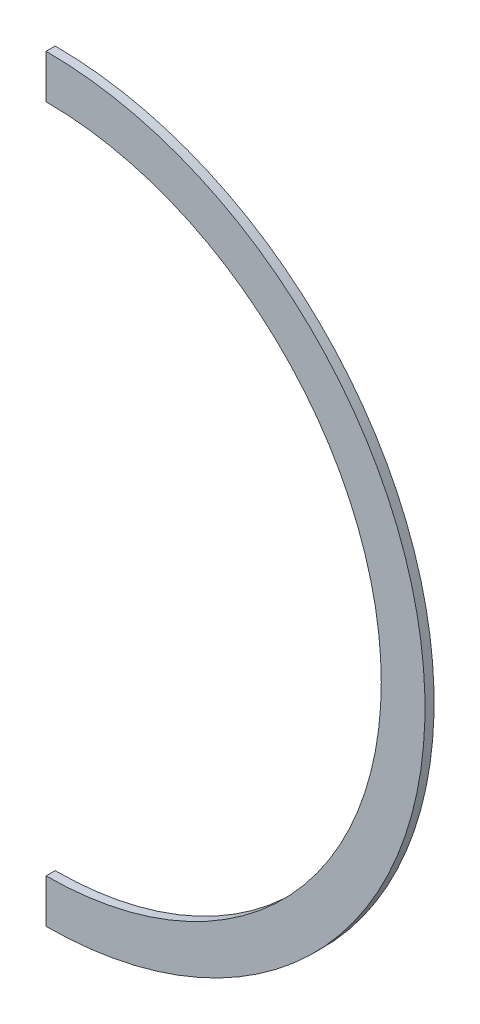
from build123d import *

# Parameters (mm, degrees)
SKETCH2_R           = 116.84
BOSS_EXTRUDE1_DEPTH = 1.5875
SKETCH3_W           = 232.210592103
SKETCH3_H           = 398.954583541
CUT_EXTRUDE1_DEPTH  = 190.3271535


with BuildPart() as part:
    # Sketch2 → Boss-Extrude1 (new, symmetric)
    with BuildSketch(Plane.XY):
        with BuildLine():
            ThreePointArc((-1.651, 128.513680847), (-113.442050185, 64.090342472), (-116.977164172, -64.88681984))
            ThreePointArc((-116.977164172, -64.88681984), (-116.591332217, -65.617160575), (-116.200940475, -66.34507415))
            ThreePointArc((-116.200940475, -66.34507415), (-115.806144035, -67.070277165), (-115.406821703, -67.79299794))
            ThreePointArc((-115.406821703, -67.79299794), (0, -135.636), (115.406821703, -67.79299794))
            ThreePointArc((115.406821703, -67.79299794), (115.8045128, -67.073251319), (116.19771518, -66.351042694))
            ThreePointArc((116.19771518, -66.351042694), (116.589738302, -65.620154894), (116.977164172, -64.88681984))
            ThreePointArc((116.977164172, -64.88681984), (113.442050185, 64.090342472), (1.651, 128.513680847))
            ThreePointArc((1.651, 128.513680847), (0.825516124, 128.521420187), (0, 128.524))
            ThreePointArc((0, 128.524), (-0.825516124, 128.521420187), (-1.651, 128.513680847))
        make_face()
        with Locations((0, -3.556)):
            Circle(SKETCH2_R, mode=Mode.SUBTRACT)
    extrude(amount=BOSS_EXTRUDE1_DEPTH, both=True)

    # Sketch3 → Cut-Extrude1 (cut, through all)
    with BuildSketch(Plane(origin=(0, 0, 0), x_dir=(0, 0, -1), z_dir=(1, 0, 0))):
        with Locations((6.714523145, -6.913261573)):
            Rectangle(SKETCH3_W, SKETCH3_H)
    extrude(amount=-CUT_EXTRUDE1_DEPTH, mode=Mode.SUBTRACT)


solid = part.part
